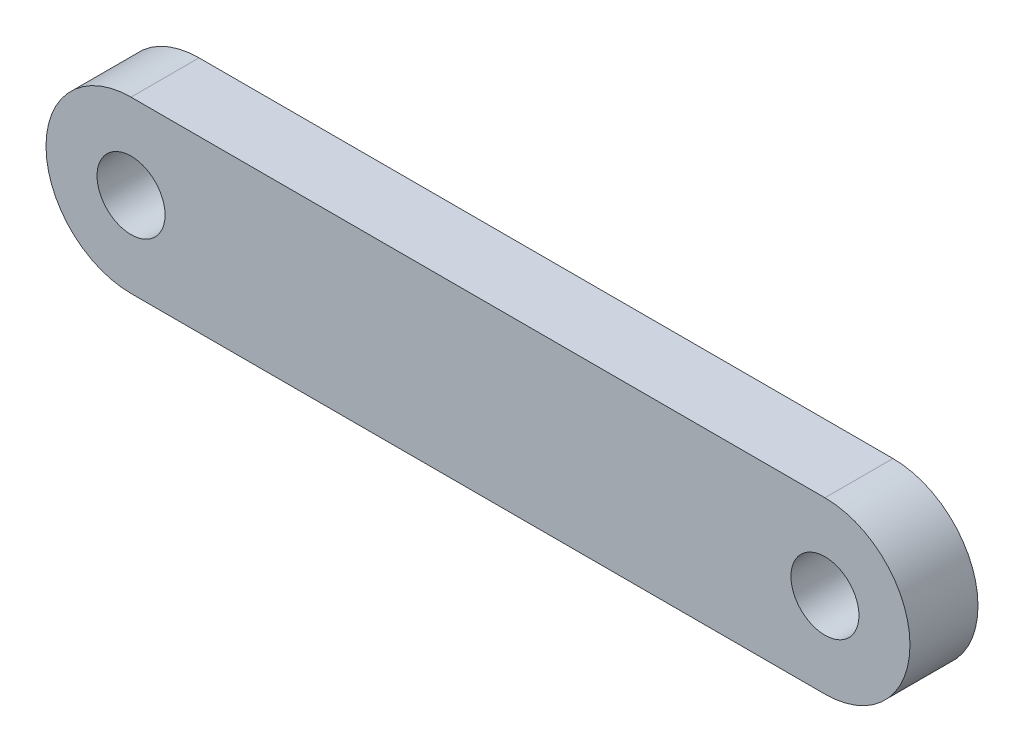
from build123d import *

# Parameters (mm, degrees)
SKETCH1_R           = 1.27
BOSS_EXTRUDE2_DEPTH = 2.54


with BuildPart() as part:
    # Sketch1 → Boss-Extrude2 (new body)
    with BuildSketch(Plane.XY):
        with BuildLine():
            Line((25.908, 3.175), (0, 3.175))
            ThreePointArc((0, 3.175), (-3.175, 0), (0, -3.175))
            Line((0, -3.175), (25.908, -3.175))
            ThreePointArc((25.908, -3.175), (29.083, 0), (25.908, 3.175))
        make_face()
        with Locations((25.908, 0)):
            Circle(SKETCH1_R, mode=Mode.SUBTRACT)
        Circle(SKETCH1_R, mode=Mode.SUBTRACT)
    extrude(amount=BOSS_EXTRUDE2_DEPTH)


solid = part.part
